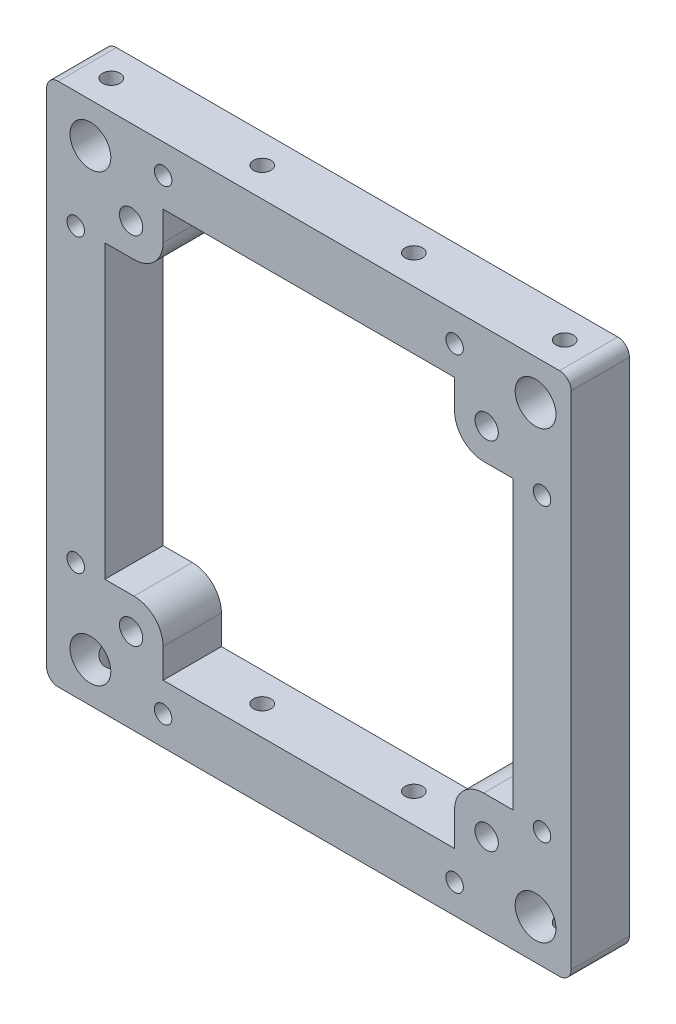
from build123d import *

# Parameters (mm, degrees)
SKETCH1_R           = 3.5
SKETCH1_R_2         = 2
BOSS_EXTRUDE1_DEPTH = 10
FILLET3_R           = 2
SKETCH3_R           = 1.5
CUT_EXTRUDE2_DEPTH  = 90
CUT_EXTRUDE4_REACH  = 103.119
SKETCH5_R           = 1.5
CUT_EXTRUDE5_REACH  = 103.119
SKETCH6_R           = 1.5
FILLET5_R           = 5
CUT_EXTRUDE6_REACH  = 97.818
SKETCH7_R           = 1.5


with BuildPart() as part:
    # Sketch1 → Boss-Extrude1 (new body)
    with BuildSketch(Plane.XY):
        Polygon((45, -6), (-45, -6), (-45, 7.639870687), (-45, 70.360129313), (-45, 84), (45, 84), (45, 70.360129313), (45, 7.639870687), align=None)
        with Locations((-37.478097873, 0.819935343)):
            Circle(SKETCH1_R, mode=Mode.SUBTRACT)
        with Locations((38.891902127, 0.815)):
            Circle(SKETCH1_R, mode=Mode.SUBTRACT)
        with Locations((-37.478097873, 77.180064657)):
            Circle(SKETCH1_R, mode=Mode.SUBTRACT)
        with Locations((38.891902127, 77.185)):
            Circle(SKETCH1_R, mode=Mode.SUBTRACT)
        with Locations((-30.5, 69.5)):
            Circle(SKETCH1_R_2, mode=Mode.SUBTRACT)
        with Locations((30.5, 69.5)):
            Circle(SKETCH1_R_2, mode=Mode.SUBTRACT)
        with Locations((30.5, 8.5)):
            Circle(SKETCH1_R_2, mode=Mode.SUBTRACT)
        with Locations((-30.5, 8.5)):
            Circle(SKETCH1_R_2, mode=Mode.SUBTRACT)
        Polygon((-25, 74), (25, 74), (25, 64), (35, 64), (35, 14.743490637), (25, 14.743490637), (25, 4), (-25, 4), (-25, 14), (-35, 14), (-35, 64), (-25, 64), align=None, mode=Mode.SUBTRACT)
    extrude(amount=BOSS_EXTRUDE1_DEPTH)

    # Fillet3
    fillet3_edges = [part.edges().sort_by_distance(p)[0] for p in [
        (-45, 84, 5),
        (45, 84, 5),
        (45, -6, 5),
        (-45, -6, 5),
    ]]
    fillet(fillet3_edges, radius=FILLET3_R)

    # Sketch3 → Cut-Extrude2 (cut)
    with BuildSketch(Plane.XZ.offset(6)):
        with Locations((-13, 5)):
            Circle(SKETCH3_R)
        with Locations((13, 5)):
            Circle(SKETCH3_R)
    extrude(amount=-CUT_EXTRUDE2_DEPTH, mode=Mode.SUBTRACT)

    # Sketch5 → Cut-Extrude4 (cut, up to next)
    with BuildSketch(Plane.XZ.offset(6), mode=Mode.PRIVATE) as cut_extrude4_sk1:
        with Locations((-38.89, 5)):
            Circle(SKETCH5_R)
    cut_extrude4_tool1 = extrude(cut_extrude4_sk1.sketch, amount=-CUT_EXTRUDE4_REACH, mode=Mode.PRIVATE) & part.part
    # Sketch5 → Cut-Extrude4 (cut, up to next)
    with BuildSketch(Plane.XZ.offset(6), mode=Mode.PRIVATE) as cut_extrude4_sk2:
        with Locations((38.89, 5)):
            Circle(SKETCH5_R)
    cut_extrude4_tool2 = extrude(cut_extrude4_sk2.sketch, amount=-CUT_EXTRUDE4_REACH, mode=Mode.PRIVATE) & part.part
    add(cut_extrude4_tool1.solids().sort_by_distance((-38.89, -6, 5))[0], mode=Mode.SUBTRACT)
    add(cut_extrude4_tool2.solids().sort_by_distance((38.89, -6, 5))[0], mode=Mode.SUBTRACT)

    # Sketch6 → Cut-Extrude5 (cut, up to next)
    with BuildSketch(Plane(origin=(0, 84, 0), x_dir=(1, 0, 0), z_dir=(0, 1, 0)), mode=Mode.PRIVATE) as cut_extrude5_sk1:
        with Locations((-38.89, -5)):
            Circle(SKETCH6_R)
    cut_extrude5_tool1 = extrude(cut_extrude5_sk1.sketch, amount=-CUT_EXTRUDE5_REACH, mode=Mode.PRIVATE) & part.part
    # Sketch6 → Cut-Extrude5 (cut, up to next)
    with BuildSketch(Plane(origin=(0, 84, 0), x_dir=(1, 0, 0), z_dir=(0, 1, 0)), mode=Mode.PRIVATE) as cut_extrude5_sk2:
        with Locations((38.89, -5)):
            Circle(SKETCH6_R)
    cut_extrude5_tool2 = extrude(cut_extrude5_sk2.sketch, amount=-CUT_EXTRUDE5_REACH, mode=Mode.PRIVATE) & part.part
    add(cut_extrude5_tool1.solids().sort_by_distance((-38.89, 84, 5))[0], mode=Mode.SUBTRACT)
    add(cut_extrude5_tool2.solids().sort_by_distance((38.89, 84, 5))[0], mode=Mode.SUBTRACT)

    # Fillet5
    fillet5_edges = [part.edges().sort_by_distance(p)[0] for p in [
        (25, 14.743490637, 5),
        (-25, 14, 5),
        (-25, 64, 5),
        (25, 64, 5),
    ]]
    fillet(fillet5_edges, radius=FILLET5_R)

    # Sketch7 → Cut-Extrude6 (cut, up to next)
    with BuildSketch(Plane.XY.offset(10), mode=Mode.PRIVATE) as cut_extrude6_sk1:
        with Locations((-25, 79)):
            Circle(SKETCH7_R)
    cut_extrude6_tool1 = extrude(cut_extrude6_sk1.sketch, amount=-CUT_EXTRUDE6_REACH, mode=Mode.PRIVATE) & part.part
    # Sketch7 → Cut-Extrude6 (cut, up to next)
    with BuildSketch(Plane.XY.offset(10), mode=Mode.PRIVATE) as cut_extrude6_sk2:
        with Locations((25, 79)):
            Circle(SKETCH7_R)
    cut_extrude6_tool2 = extrude(cut_extrude6_sk2.sketch, amount=-CUT_EXTRUDE6_REACH, mode=Mode.PRIVATE) & part.part
    # Sketch7 → Cut-Extrude6 (cut, up to next)
    with BuildSketch(Plane.XY.offset(10), mode=Mode.PRIVATE) as cut_extrude6_sk3:
        with Locations((25, -1)):
            Circle(SKETCH7_R)
    cut_extrude6_tool3 = extrude(cut_extrude6_sk3.sketch, amount=-CUT_EXTRUDE6_REACH, mode=Mode.PRIVATE) & part.part
    # Sketch7 → Cut-Extrude6 (cut, up to next)
    with BuildSketch(Plane.XY.offset(10), mode=Mode.PRIVATE) as cut_extrude6_sk4:
        with Locations((-25, -1)):
            Circle(SKETCH7_R)
    cut_extrude6_tool4 = extrude(cut_extrude6_sk4.sketch, amount=-CUT_EXTRUDE6_REACH, mode=Mode.PRIVATE) & part.part
    # Sketch7 → Cut-Extrude6 (cut, up to next)
    with BuildSketch(Plane.XY.offset(10), mode=Mode.PRIVATE) as cut_extrude6_sk5:
        with Locations((40, 64)):
            Circle(SKETCH7_R)
    cut_extrude6_tool5 = extrude(cut_extrude6_sk5.sketch, amount=-CUT_EXTRUDE6_REACH, mode=Mode.PRIVATE) & part.part
    # Sketch7 → Cut-Extrude6 (cut, up to next)
    with BuildSketch(Plane.XY.offset(10), mode=Mode.PRIVATE) as cut_extrude6_sk6:
        with Locations((40, 14)):
            Circle(SKETCH7_R)
    cut_extrude6_tool6 = extrude(cut_extrude6_sk6.sketch, amount=-CUT_EXTRUDE6_REACH, mode=Mode.PRIVATE) & part.part
    # Sketch7 → Cut-Extrude6 (cut, up to next)
    with BuildSketch(Plane.XY.offset(10), mode=Mode.PRIVATE) as cut_extrude6_sk7:
        with Locations((-40, 14)):
            Circle(SKETCH7_R)
    cut_extrude6_tool7 = extrude(cut_extrude6_sk7.sketch, amount=-CUT_EXTRUDE6_REACH, mode=Mode.PRIVATE) & part.part
    # Sketch7 → Cut-Extrude6 (cut, up to next)
    with BuildSketch(Plane.XY.offset(10), mode=Mode.PRIVATE) as cut_extrude6_sk8:
        with Locations((-40, 64)):
            Circle(SKETCH7_R)
    cut_extrude6_tool8 = extrude(cut_extrude6_sk8.sketch, amount=-CUT_EXTRUDE6_REACH, mode=Mode.PRIVATE) & part.part
    add(cut_extrude6_tool1.solids().sort_by_distance((-25, 79, 10))[0], mode=Mode.SUBTRACT)
    add(cut_extrude6_tool2.solids().sort_by_distance((25, 79, 10))[0], mode=Mode.SUBTRACT)
    add(cut_extrude6_tool3.solids().sort_by_distance((25, -1, 10))[0], mode=Mode.SUBTRACT)
    add(cut_extrude6_tool4.solids().sort_by_distance((-25, -1, 10))[0], mode=Mode.SUBTRACT)
    add(cut_extrude6_tool5.solids().sort_by_distance((40, 64, 10))[0], mode=Mode.SUBTRACT)
    add(cut_extrude6_tool6.solids().sort_by_distance((40, 14, 10))[0], mode=Mode.SUBTRACT)
    add(cut_extrude6_tool7.solids().sort_by_distance((-40, 14, 10))[0], mode=Mode.SUBTRACT)
    add(cut_extrude6_tool8.solids().sort_by_distance((-40, 64, 10))[0], mode=Mode.SUBTRACT)


solid = part.part
